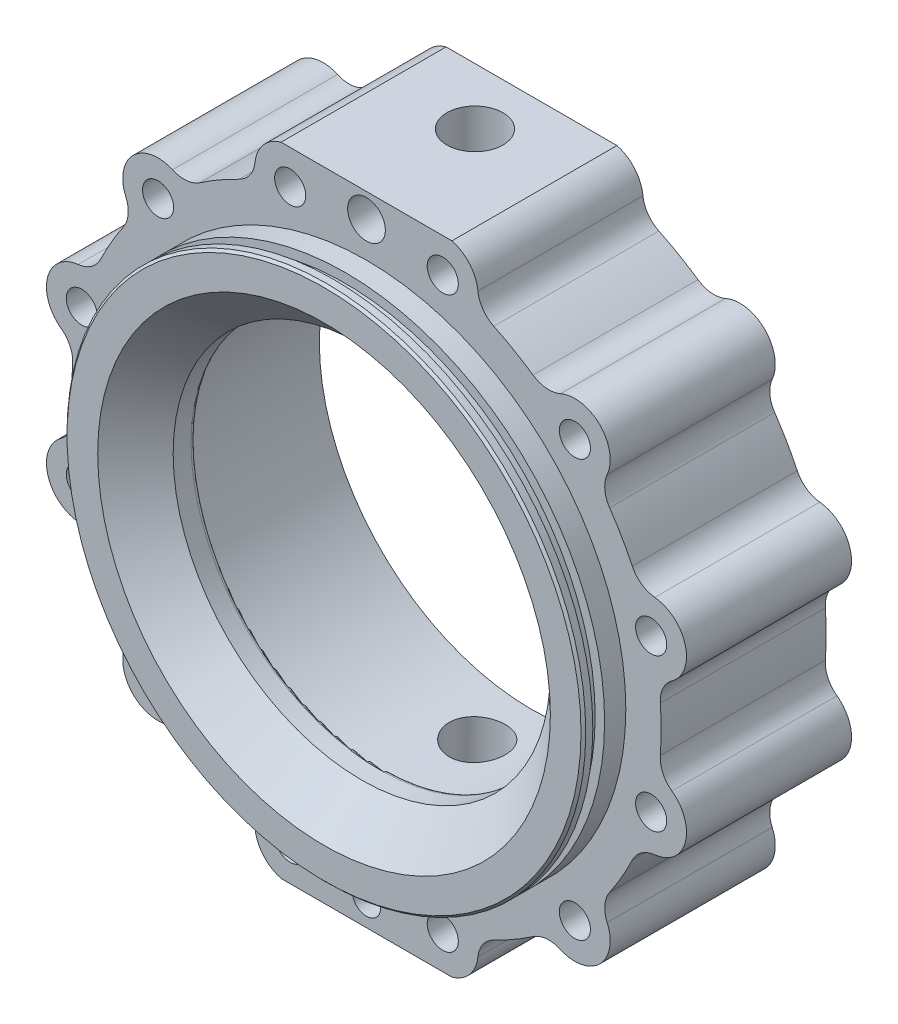
from build123d import *

# Parameters (mm, degrees)
SKETCH2_R                        = 3
CUT_EXTRUDE1_DEPTH               = 9
SKETCH3_R                        = 4
CUT_EXTRUDE2_DEPTH               = 10
SKETCH9_W                        = 2
SKETCH9_H                        = 2.5
CHAMFER1_SIZE                    = 0.5
M6_CLEARANCE_HOLE1_D             = 6.6
FILLET2_R                        = 1
CHAMFER2_SIZE                    = 8
LOOKSMAXXING_DEPTH               = 109.332820512
F_1_4_18_NPSM_TAPPED_HOLE1_D     = 11.8872
F_1_4_18_NPSM_TAPPED_HOLE1_DEPTH = 30.96
F_1_4_18_NPSM_TAPPED_HOLE1_TIP   = 3.571275175
F_1_4_18_NPSM_TAPPED_HOLE2_D     = 11.8872
F_1_4_18_NPSM_TAPPED_HOLE2_DEPTH = 30.96
F_1_4_18_NPSM_TAPPED_HOLE2_TIP   = 3.571275175


with BuildPart() as part:
    # Sketch1 → Revolve1 (revolve)
    with BuildSketch(Plane(origin=(0, 0, 0), x_dir=(1, 0, 0), z_dir=(0, 1, 0))):
        Polygon((-55, -18.79575879), (-55, -9.79575879), (-70, -9.79575879), (-70, 25.20424121), (-45, 25.20424121), (-45, -6), (-40, -6), (-40, -18.79575879), align=None)
    revolve(axis=Axis((0, 0, -52.707374268), (0, 0, 1)))

    # Sketch2 → Cut-Extrude1 (cut)
    with BuildSketch(Plane.XY.offset(9.79575879)):
        with Locations((0, -62.5)):
            Circle(SKETCH2_R)
    extrude(amount=-CUT_EXTRUDE1_DEPTH, mode=Mode.SUBTRACT)

    # Sketch3 → Cut-Extrude2 (cut)
    with BuildSketch(Plane.XY.offset(9.79575879)):
        with Locations((0, 62.5)):
            Circle(SKETCH3_R)
    extrude(amount=-CUT_EXTRUDE2_DEPTH, mode=Mode.SUBTRACT)

    # Sketch9 → Oring groove (revolve, cut)
    with BuildSketch(Plane(origin=(0, 0, 0), x_dir=(1, 0, 0), z_dir=(0, 1, 0))):
        with Locations((-54, -15.54575879)):
            Rectangle(SKETCH9_W, SKETCH9_H)
    revolve(axis=Axis((0, 0, -11.30771881), (0, 0, 1)), mode=Mode.SUBTRACT)

    # Chamfer1
    chamfer1_edges = [part.edges().sort_by_distance(p)[0] for p in [
        (55, 0, 18.79575879),
    ]]
    chamfer(chamfer1_edges, length=CHAMFER1_SIZE)

    # M6 Clearance Hole1 (through all)
    with Locations(Plane.XY.offset(9.79575879)):
        with Locations((-60.370364143, 16.176190319), (-44.194173824, 44.194173824), (-16.176190319, 60.370364143), (16.176190319, 60.370364143), (44.194173824, 44.194173824), (60.370364143, 16.176190319), (60.370364143, -16.176190319), (44.194173824, -44.194173824), (16.176190319, -60.370364143), (-16.176190319, -60.370364143), (-44.194173824, -44.194173824), (-60.370364143, -16.176190319), (0, 0)):
            Hole(M6_CLEARANCE_HOLE1_D / 2)

    # Fillet2
    fillet2_edges = [part.edges().sort_by_distance(p)[0] for p in [
        (40, 0, 6),
    ]]
    fillet(fillet2_edges, radius=FILLET2_R)

    # Chamfer2
    chamfer2_edges = [part.edges().sort_by_distance(p)[0] for p in [
        (40, 0, 18.79575879),
    ]]
    chamfer(chamfer2_edges, length=CHAMFER2_SIZE)

    # Sketch11 → looksmaxxing (cut, through all)
    with BuildSketch(Plane(origin=(0, 0, -25.20424121), x_dir=(-1, 0, 0), z_dir=(0, 0, -1))):
        with BuildLine():
            ThreePointArc((18.117333157, 67.61480784), (0, 70), (-18.117333157, 67.61480784))
            Line((-18.117333157, 67.61480784), (18.117333157, 67.61480784))
        make_face()
        with BuildLine():
            ThreePointArc((-23.635598574, 61.149612809), (-21.88077417, 65.239421864), (-18.117333157, 67.61480784))
            ThreePointArc((-18.117333157, 67.61480784), (-35.000000007, 60.621778261), (-49.497474694, 49.497474672))
            ThreePointArc((-49.497474694, 49.497474672), (-45.558609585, 51.569017216), (-41.139318837, 51.043835203))
            ThreePointArc((-41.139318837, 51.043835203), (-38.153781824, 50.548063323), (-35.306053693, 51.57259517))
            ThreePointArc((-35.306053693, 51.57259517), (-31.25, 54.126587737), (-27.01015071, 56.362236991))
            ThreePointArc((-27.01015071, 56.362236991), (-24.699016038, 58.316175972), (-23.635598574, 61.149612809))
        make_face()
        with BuildLine():
            ThreePointArc((49.497474665, 49.497474701), (34.999999989, 60.621778271), (18.117333157, 67.61480784))
            ThreePointArc((18.117333157, 67.61480784), (21.88077417, 65.239421864), (23.635598574, 61.149612809))
            ThreePointArc((23.635598574, 61.149612809), (24.699016038, 58.316175972), (27.01015071, 56.362236991))
            ThreePointArc((27.01015071, 56.362236991), (31.25, 54.126587737), (35.306053693, 51.57259517))
            ThreePointArc((35.306053693, 51.57259517), (38.153781824, 50.548063323), (41.139318837, 51.043835203))
            ThreePointArc((41.139318837, 51.043835203), (45.558609565, 51.56901722), (49.497474665, 49.497474701))
        make_face()
        with BuildLine():
            ThreePointArc((-51.043835203, 41.139318837), (-51.569017219, 45.55860957), (-49.497474694, 49.497474672))
            ThreePointArc((-49.497474694, 49.497474672), (-60.62177824, 35.000000042), (-67.614807811, 18.117333266))
            ThreePointArc((-67.614807811, 18.117333266), (-65.239421821, 21.880774206), (-61.149612809, 23.635598574))
            ThreePointArc((-61.149612809, 23.635598574), (-58.316175972, 24.699016038), (-56.362236991, 27.01015071))
            ThreePointArc((-56.362236991, 27.01015071), (-54.126587737, 31.25), (-51.57259517, 35.306053693))
            ThreePointArc((-51.57259517, 35.306053693), (-50.548063323, 38.153781824), (-51.043835203, 41.139318837))
        make_face()
        with BuildLine():
            ThreePointArc((67.614807872, 18.117333038), (60.621778289, 34.999999958), (49.497474665, 49.497474701))
            ThreePointArc((49.497474665, 49.497474701), (51.569017215, 45.55860959), (51.043835203, 41.139318837))
            ThreePointArc((51.043835203, 41.139318837), (50.548063323, 38.153781824), (51.57259517, 35.306053693))
            ThreePointArc((51.57259517, 35.306053693), (54.126587737, 31.25), (56.362236991, 27.01015071))
            ThreePointArc((56.362236991, 27.01015071), (58.316175972, 24.699016038), (61.149612809, 23.635598574))
            ThreePointArc((61.149612809, 23.635598574), (65.239421911, 21.88077413), (67.614807872, 18.117333038))
        make_face()
        with BuildLine():
            ThreePointArc((-64.774917411, 10.105777606), (-67.439383766, 13.6704047), (-67.614807811, 18.117333266))
            ThreePointArc((-67.614807811, 18.117333266), (-70, 5.2e-08), (-67.614807838, -18.117333166))
            ThreePointArc((-67.614807838, -18.117333166), (-67.439383749, -13.670404651), (-64.774917411, -10.105777606))
            ThreePointArc((-64.774917411, -10.105777606), (-62.852797862, -7.768112649), (-62.316204403, -4.789641821))
            ThreePointArc((-62.316204403, -4.789641821), (-62.5, 0), (-62.316204403, 4.789641821))
            ThreePointArc((-62.316204403, 4.789641821), (-62.852797862, 7.768112649), (-64.774917411, 10.105777606))
        make_face()
        with BuildLine():
            ThreePointArc((67.614807506, -18.117334404), (70, -7.07e-07), (67.614807872, 18.117333038))
            ThreePointArc((67.614807872, 18.117333038), (67.439383727, 13.670404588), (64.774917411, 10.105777606))
            ThreePointArc((64.774917411, 10.105777606), (62.852797862, 7.768112649), (62.316204403, 4.789641821))
            ThreePointArc((62.316204403, 4.789641821), (62.5, 0), (62.316204403, -4.789641821))
            ThreePointArc((62.316204403, -4.789641821), (62.852797862, -7.768112649), (64.774917411, -10.105777606))
            ThreePointArc((64.774917411, -10.105777606), (67.439383963, -13.670405254), (67.614807506, -18.117334404))
        make_face()
        with BuildLine():
            ThreePointArc((-61.149612809, -23.635598574), (-65.23942186, -21.880774173), (-67.614807838, -18.117333166))
            ThreePointArc((-67.614807838, -18.117333166), (-60.621778257, -35.000000014), (-49.497474667, -49.497474699))
            ThreePointArc((-49.497474667, -49.497474699), (-51.569017215, -45.558609589), (-51.043835203, -41.139318837))
            ThreePointArc((-51.043835203, -41.139318837), (-50.548063323, -38.153781824), (-51.57259517, -35.306053693))
            ThreePointArc((-51.57259517, -35.306053693), (-54.126587737, -31.25), (-56.362236991, -27.01015071))
            ThreePointArc((-56.362236991, -27.01015071), (-58.316175972, -24.699016038), (-61.149612809, -23.635598574))
        make_face()
        with BuildLine():
            ThreePointArc((-41.139318837, -51.043835203), (-45.558609566, -51.56901722), (-49.497474667, -49.497474699))
            ThreePointArc((-49.497474667, -49.497474699), (-34.99999999, -60.621778271), (-18.117333157, -67.61480784))
            ThreePointArc((-18.117333157, -67.61480784), (-21.88077417, -65.239421864), (-23.635598574, -61.149612809))
            ThreePointArc((-23.635598574, -61.149612809), (-24.699016038, -58.316175972), (-27.01015071, -56.362236991))
            ThreePointArc((-27.01015071, -56.362236991), (-31.25, -54.126587737), (-35.306053693, -51.57259517))
            ThreePointArc((-35.306053693, -51.57259517), (-38.153781824, -50.548063323), (-41.139318837, -51.043835203))
        make_face()
        with BuildLine():
            ThreePointArc((49.497474714, -49.497474652), (60.621777953, -35.00000054), (67.614807506, -18.117334404))
            ThreePointArc((67.614807506, -18.117334404), (65.239421373, -21.880774589), (61.149612809, -23.635598574))
            ThreePointArc((61.149612809, -23.635598574), (58.316175972, -24.699016038), (56.362236991, -27.01015071))
            ThreePointArc((56.362236991, -27.01015071), (54.126587737, -31.25), (51.57259517, -35.306053693))
            ThreePointArc((51.57259517, -35.306053693), (50.548063323, -38.153781824), (51.043835203, -41.139318837))
            ThreePointArc((51.043835203, -41.139318837), (51.569017221, -45.558609556), (49.497474714, -49.497474652))
        make_face()
        with BuildLine():
            Line((18.117333157, -67.61480784), (-18.117333157, -67.61480784))
            ThreePointArc((-18.117333157, -67.61480784), (0, -70), (18.117333157, -67.61480784))
        make_face()
        with BuildLine():
            ThreePointArc((18.117333157, -67.61480784), (35.000000019, -60.621778254), (49.497474714, -49.497474652))
            ThreePointArc((49.497474714, -49.497474652), (45.558609599, -51.569017213), (41.139318837, -51.043835203))
            ThreePointArc((41.139318837, -51.043835203), (38.153781824, -50.548063323), (35.306053693, -51.57259517))
            ThreePointArc((35.306053693, -51.57259517), (31.25, -54.126587737), (27.01015071, -56.362236991))
            ThreePointArc((27.01015071, -56.362236991), (24.699016038, -58.316175972), (23.635598574, -61.149612809))
            ThreePointArc((23.635598574, -61.149612809), (21.88077417, -65.239421864), (18.117333157, -67.61480784))
        make_face()
    extrude(amount=-LOOKSMAXXING_DEPTH, mode=Mode.SUBTRACT)

    # 1/4-18 NPSM Tapped Hole1
    with Locations(Plane(origin=(0, 67.61480784, 0), x_dir=(1, 0, 0), z_dir=(0, 1, 0))):
        with Locations((0, 13.20424121)):
            Hole(F_1_4_18_NPSM_TAPPED_HOLE1_D / 2, depth=F_1_4_18_NPSM_TAPPED_HOLE1_DEPTH)
            with Locations((0, 0, -(F_1_4_18_NPSM_TAPPED_HOLE1_DEPTH + F_1_4_18_NPSM_TAPPED_HOLE1_TIP / 2))):  # 118° drill point
                Cone(0, F_1_4_18_NPSM_TAPPED_HOLE1_D / 2, F_1_4_18_NPSM_TAPPED_HOLE1_TIP, mode=Mode.SUBTRACT)

    # 1/4-18 NPSM Tapped Hole2
    with Locations(Plane.XZ.offset(67.61480784)):
        with Locations((0, -13.70424121)):
            Hole(F_1_4_18_NPSM_TAPPED_HOLE2_D / 2, depth=F_1_4_18_NPSM_TAPPED_HOLE2_DEPTH)
            with Locations((0, 0, -(F_1_4_18_NPSM_TAPPED_HOLE2_DEPTH + F_1_4_18_NPSM_TAPPED_HOLE2_TIP / 2))):  # 118° drill point
                Cone(0, F_1_4_18_NPSM_TAPPED_HOLE2_D / 2, F_1_4_18_NPSM_TAPPED_HOLE2_TIP, mode=Mode.SUBTRACT)


solid = part.part
